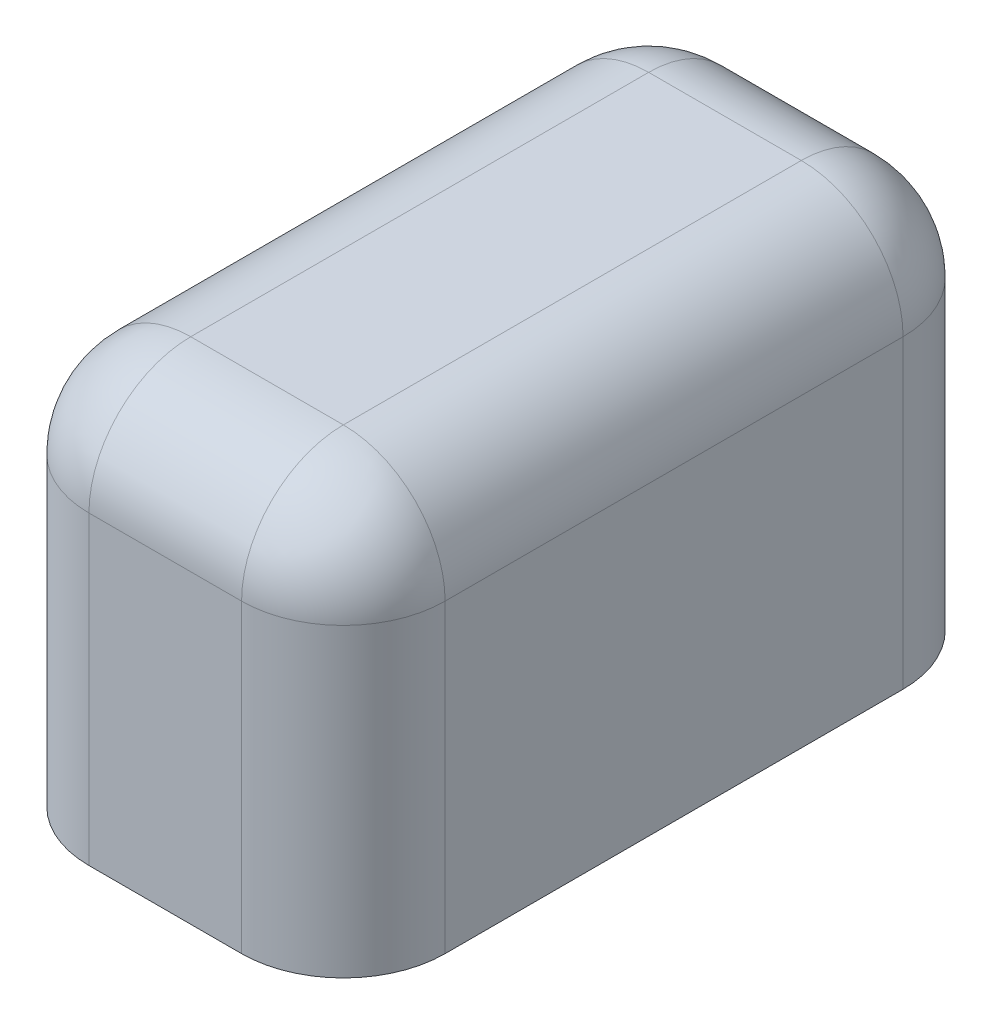
from build123d import *

# Parameters (mm, degrees)
SKETCH1_W           = 16.51
SKETCH1_H           = 10.16
BOSS_EXTRUDE1_DEPTH = 4.445
FILLET1_R           = 2.54


with BuildPart() as part:
    # Sketch1 → Boss-Extrude1 (new, symmetric)
    with BuildSketch(Plane(origin=(0, 0, 0), x_dir=(0, 0, -1), z_dir=(1, 0, 0))):
        with Locations((8.255, 5.08)):
            Rectangle(SKETCH1_W, SKETCH1_H)
    extrude(amount=BOSS_EXTRUDE1_DEPTH, both=True)

    # Fillet1
    fillet1_edges = [part.edges().sort_by_distance(p)[0] for p in [
        (0, 10.16, -16.51),
        (-4.445, 10.16, -8.255),
        (0, 10.16, 0),
        (4.445, 10.16, -8.255),
        (4.445, 5.08, -16.51),
        (-4.445, 5.08, -16.51),
        (-4.445, 5.08, 0),
        (4.445, 5.08, 0),
    ]]
    fillet(fillet1_edges, radius=FILLET1_R)


solid = part.part
